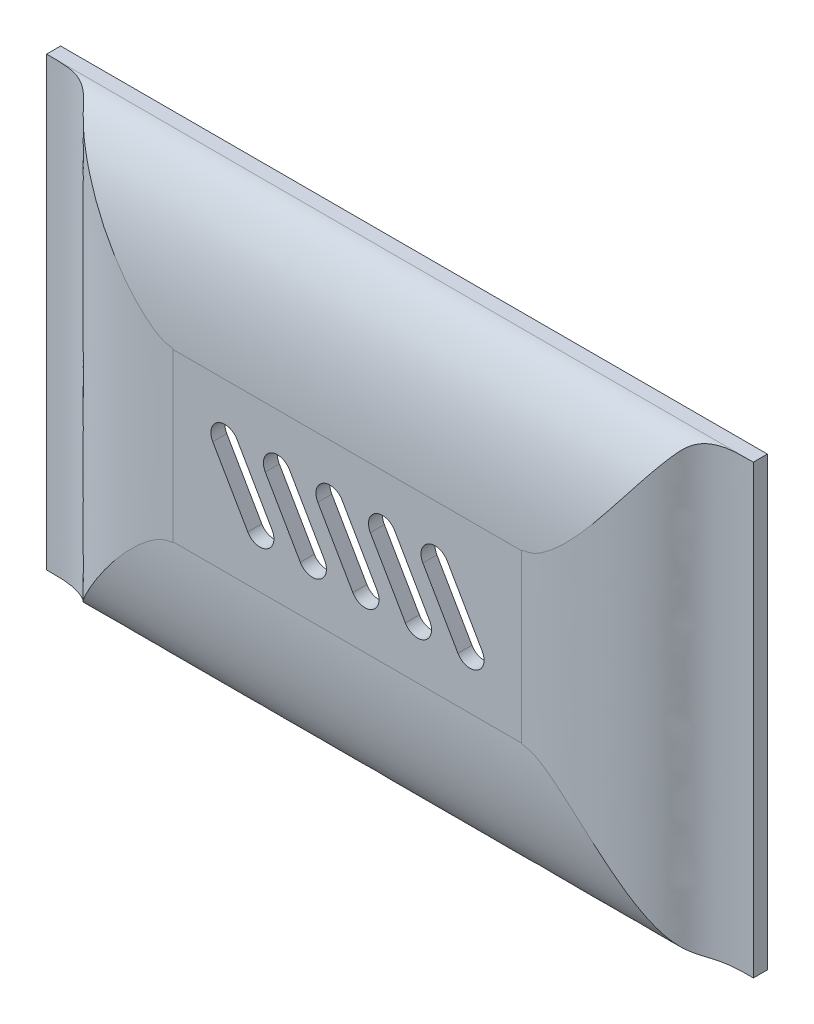
from build123d import *

# Parameters (mm, degrees)
SKETCH1_W               = 201.802478188
SKETCH1_H               = 127.56183951
BOSS_EXTRUDE1_DEPTH     = 20
CUT_EXTRUDE1_DEPTH      = 122.033325061
CUT_EXTRUDE1_DEPTH_BACK = 122.033325061
SKETCH1_2_W             = 201.802478188
SKETCH1_2_H             = 127.56183951
BOSS_EXTRUDE2_DEPTH     = 4
FILLET2_SIZE            = 40
FILLET2_SIZE_2          = 15
FILLET3_START           = -102
FILLET3_DEPTH           = 204
SHELL1_T                = -4
CUT_EXTRUDE2_DEPTH      = 121.872105204


with BuildPart() as part:
    # Sketch1 → Boss-Extrude1 (new body)
    with BuildSketch(Plane.XY):
        Rectangle(SKETCH1_W, SKETCH1_H)
    extrude(amount=BOSS_EXTRUDE1_DEPTH)

    # Sketch2 → Cut-Extrude1 (cut, two sides: drawn at the far end of the back side and taken through both)
    with BuildSketch(Plane(origin=(0, 0, 0), x_dir=(1, 0, 0), z_dir=(0, 1, 0)).offset(-CUT_EXTRUDE1_DEPTH_BACK)):
        with BuildLine():
            Line((-100.901239094, 0), (-100.901239094, -20))
            Line((-100.901239094, -20), (100.901239094, -20))
            Line((100.901239094, -20), (100.901239094, 0))
            add(Edge.make_bspline(
                [(49.743410816, -15), (59.05982943, -14.989420567), (72.358753736, -15.171700571), (83.478703818, -7.315461837), (86.820559083, -3.200705026), (92.445223639, 0.125813416), (97.600488085, -0.009833262), (100.901239094, 0)],
                knots=[0, 0, 0, 0, 0.506951855, 0.623400352, 0.692673862, 0.780523058, 0.950426798, 0.950426798, 0.950426798, 0.950426798], degree=3))
            Line((49.743410816, -15), (-49.743410816, -15))
            add(Edge.make_bspline(
                [(-49.743410816, -15), (-59.05982943, -14.989420567), (-72.358753736, -15.171700571), (-83.478703818, -7.315461837), (-86.820559083, -3.200705026), (-92.445223639, 0.125813416), (-97.600488085, -0.009833262), (-100.901239094, 0)],
                knots=[0, 0, 0, 0, 0.506951855, 0.623400352, 0.692673862, 0.780523058, 0.950426798, 0.950426798, 0.950426798, 0.950426798], degree=3))
        make_face()
    extrude(amount=CUT_EXTRUDE1_DEPTH + CUT_EXTRUDE1_DEPTH_BACK, mode=Mode.SUBTRACT)

    # Sketch1<2> → Boss-Extrude2 (add)
    with BuildSketch(Plane.XY):
        Rectangle(SKETCH1_2_W, SKETCH1_2_H)
    extrude(amount=-BOSS_EXTRUDE2_DEPTH)

    # Fillet2
    # a fillet whose section is not a circle: 40, 15 mm, written as the material it takes off along each edge
    with BuildSketch(Plane(origin=(149.743410816, 63.780919755, 15), x_dir=(0, -1, 0), z_dir=(-1, 0, 0))) as fillet2_piece_1:
        with BuildLine():
            Bezier((FILLET2_SIZE, 0), (0, 0), (0, -FILLET2_SIZE_2), weights=[1, 0.707106781, 1])
            Line((0, -FILLET2_SIZE_2), (0, 0))
            Line((0, 0), (FILLET2_SIZE, 0))
        make_face()
    extrude(amount=299.486821632, mode=Mode.SUBTRACT)

    # Fillet3: read off the stored shape, not the designer's step
    # Fillet3 outline → Fillet3 (cut)
    with BuildSketch(Plane.YZ.offset(FILLET3_START)):
        with BuildLine():
            add(Edge.make_bspline(
                [(-23.780919755, 15), (-63.780919755, 15), (-63.780919755, 0)],
                knots=[0, 0, 0, 1, 1, 1], degree=2, weights=[1, 0.707106781, 1]))
            Line((-23.780919755, 15), (-63.780919755, 15))
            Line((-63.780919755, 15), (-63.780919755, 0))
        make_face()
    extrude(amount=FILLET3_DEPTH, mode=Mode.SUBTRACT)

    # Shell1
    shell1_openings = [part.faces().sort_by_distance(p)[0] for p in [
        (0, 0, -4),
    ]]
    offset(amount=SHELL1_T, openings=shell1_openings)

    # Sketch5 → Cut-Extrude2 (cut, through all)
    with BuildSketch(Plane(origin=(0, 0, 15), x_dir=(-1, 0, 0), z_dir=(0, 0, -1))):
        with BuildLine():
            ThreePointArc((-8.464101615, -6.660254038), (-7, -12.124355653), (-1.535898385, -10.660254038))
            Line((-1.535898385, -10.660254038), (8.464101615, 6.660254038))
            ThreePointArc((8.464101615, 6.660254038), (7, 12.124355653), (1.535898385, 10.660254038))
            Line((1.535898385, 10.660254038), (-8.464101615, -6.660254038))
        make_face()
        with BuildLine():
            ThreePointArc((6.535898385, -6.660254038), (8, -12.124355653), (13.464101615, -10.660254038))
            Line((13.464101615, -10.660254038), (23.464101615, 6.660254038))
            ThreePointArc((23.464101615, 6.660254038), (22, 12.124355653), (16.535898385, 10.660254038))
            Line((16.535898385, 10.660254038), (6.535898385, -6.660254038))
        make_face()
        with BuildLine():
            ThreePointArc((21.535898385, -6.660254038), (23, -12.124355653), (28.464101615, -10.660254038))
            Line((28.464101615, -10.660254038), (38.464101615, 6.660254038))
            ThreePointArc((38.464101615, 6.660254038), (37, 12.124355653), (31.535898385, 10.660254038))
            Line((31.535898385, 10.660254038), (21.535898385, -6.660254038))
        make_face()
        with BuildLine():
            ThreePointArc((-23.464101615, -6.660254038), (-22, -12.124355653), (-16.535898385, -10.660254038))
            Line((-16.535898385, -10.660254038), (-6.535898385, 6.660254038))
            ThreePointArc((-6.535898385, 6.660254038), (-8, 12.124355653), (-13.464101615, 10.660254038))
            Line((-13.464101615, 10.660254038), (-23.464101615, -6.660254038))
        make_face()
        with BuildLine():
            ThreePointArc((-38.464101615, -6.660254038), (-37, -12.124355653), (-31.535898385, -10.660254038))
            Line((-31.535898385, -10.660254038), (-21.535898385, 6.660254038))
            ThreePointArc((-21.535898385, 6.660254038), (-23, 12.124355653), (-28.464101615, 10.660254038))
            Line((-28.464101615, 10.660254038), (-38.464101615, -6.660254038))
        make_face()
    extrude(amount=CUT_EXTRUDE2_DEPTH, mode=Mode.SUBTRACT)


solid = part.part
